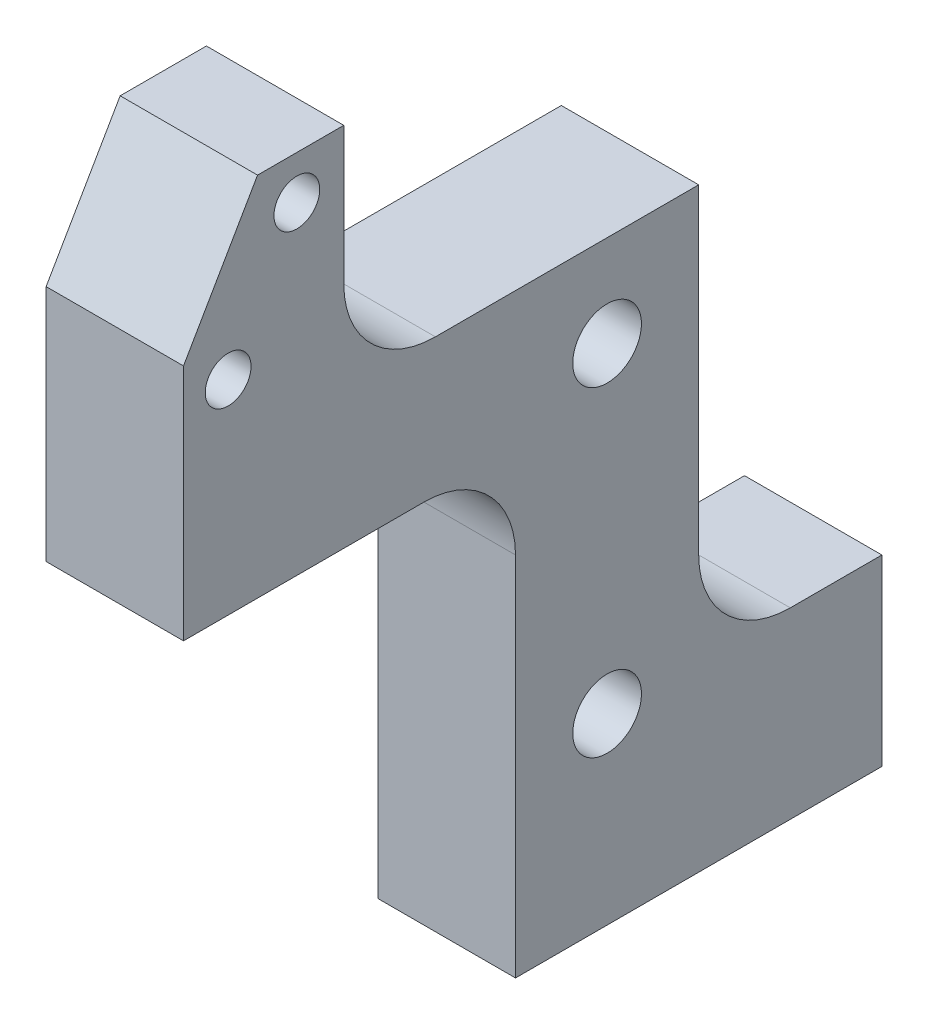
from build123d import *

# Parameters (mm, degrees)
SKETCH1_R                       = 1.5
SKETCH1_R_2                     = 1
BOSS_EXTRUDE1_DEPTH             = 6
FILLET1_R                       = 4
TAP_DRILL_FOR_M3X0_5_TAP1_D     = 2.5
TAP_DRILL_FOR_M3X0_5_TAP1_DEPTH = 4
SKETCH4_R                       = 1
CUT_EXTRUDE1_DEPTH              = 3
SKETCH5_R                       = 3
CUT_EXTRUDE2_DEPTH              = 3


with BuildPart() as part:
    # Sketch1 → Boss-Extrude1 (new body)
    with BuildSketch(Plane(origin=(0, 0, 0), x_dir=(0, 0, -1), z_dir=(1, 0, 0))):
        Polygon((30.5, 0), (14.5, 0), (14.5, 20), (0, 20), (0, 30.4), (3.233161507, 36), (7, 36), (7, 26), (22.5, 26), (22.5, 8), (30.5, 8), align=None)
        with Locations((18.5, 8)):
            Circle(SKETCH1_R, mode=Mode.SUBTRACT)
        with Locations((18.5, 22)):
            Circle(SKETCH1_R, mode=Mode.SUBTRACT)
        with Locations((1.95, 28.91)):
            Circle(SKETCH1_R_2, mode=Mode.SUBTRACT)
        with Locations((4.95, 34.106152423)):
            Circle(SKETCH1_R_2, mode=Mode.SUBTRACT)
    extrude(amount=BOSS_EXTRUDE1_DEPTH)

    # Fillet1
    fillet1_edges = [part.edges().sort_by_distance(p)[0] for p in [
        (3, 8, -22.5),
        (3, 20, -14.5),
        (3, 26, -7),
    ]]
    fillet(fillet1_edges, radius=FILLET1_R)

    # Tap Drill for M3x0.5 Tap1
    with Locations(Plane(origin=(0, 0, 0), x_dir=(-1, 0, 0), z_dir=(0, -1, 0))):
        with Locations((-3, 17.5), (-3, 27.5)):
            Hole(TAP_DRILL_FOR_M3X0_5_TAP1_D / 2, depth=TAP_DRILL_FOR_M3X0_5_TAP1_DEPTH)

    # Sketch4 → Cut-Extrude1 (cut)
    with BuildSketch(Plane.XZ):
        with Locations((3, -22.5)):
            Circle(SKETCH4_R)
    extrude(amount=-CUT_EXTRUDE1_DEPTH, mode=Mode.SUBTRACT)

    # Sketch5 → Cut-Extrude2 (cut)
    with BuildSketch(Plane(origin=(0, 0, 0), x_dir=(0, 0, -1), z_dir=(1, 0, 0))):
        with Locations((18.5, 22)):
            Circle(SKETCH5_R)
        with Locations((18.5, 8)):
            Circle(SKETCH5_R)
    extrude(amount=CUT_EXTRUDE2_DEPTH, mode=Mode.SUBTRACT)


solid = part.part
